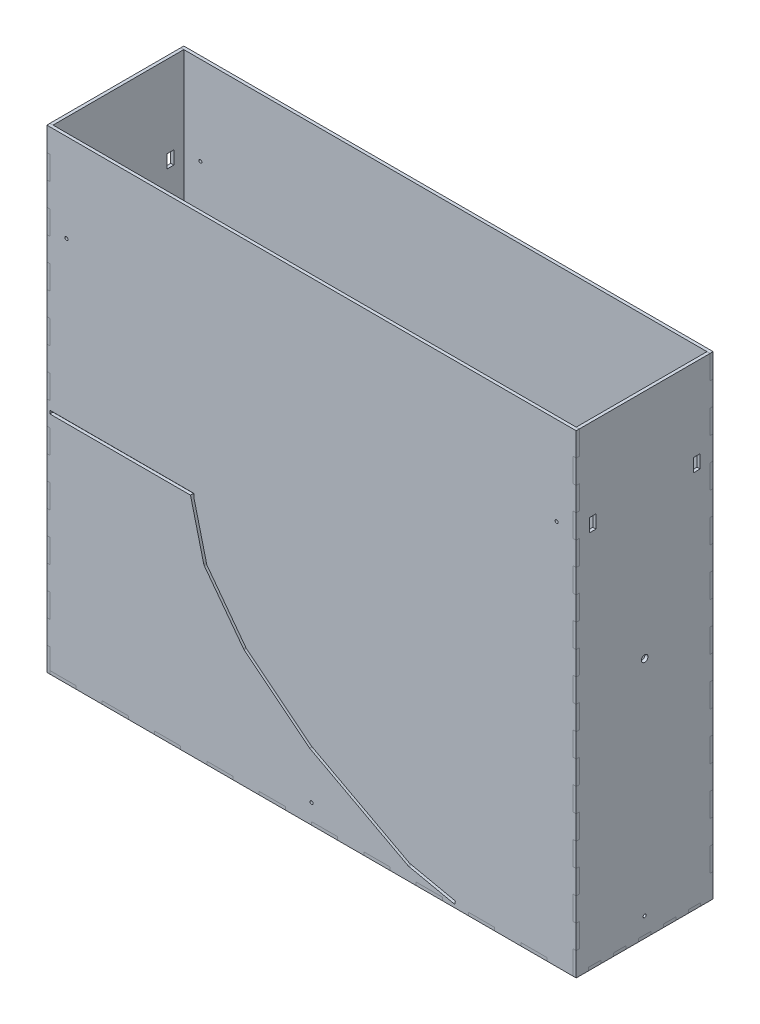
from build123d import *

# Parameters (mm, degrees)
SKETCH1_W                     = 513.9944
SKETCH1_H                     = 132.9944
SKETCH1_W_2                   = 508
SKETCH1_H_2                   = 127
BASE_EXTRUDE_DEPTH            = 2.9972
SKETCH1_3_W                   = 513.9944
SKETCH1_3_H                   = 132.9944
SKETCH1_3_W_2                 = 508
SKETCH1_3_H_2                 = 127
WALL_EXTRUDE_DEPTH            = 460.1972
SKETCH2_W                     = 139.7
SKETCH2_H                     = 3.1242
CUT_EXTRUDE2_DEPTH            = 544.614324799
SPLIT3_DEPTH                  = 2.9972
SPLIT3_2_DEPTH                = 2.9972
SPLIT2_START                  = -63.5
SPLIT2_OUTLINE_W              = 2.9972
SPLIT2_OUTLINE_H              = 457.2
SPLIT2_DEPTH                  = 127
SPLIT2_START_2                = -66.4972
SPLIT2_2_OUTLINE_W            = 2.9972
SPLIT2_2_OUTLINE_H            = 23.00986
SPLIT2_2_OUTLINE_H_2          = 20.01266
SPLIT2_2_DEPTH                = 132.9944
SPLIT2_3_OUTLINE_W            = 2.9972
SPLIT2_3_OUTLINE_H            = 2.9972
SPLIT2_3_DEPTH                = 12.0904
SPLIT2_START_3                = -42.3164
SPLIT2_4_OUTLINE_W            = 2.9972
SPLIT2_4_OUTLINE_H            = 2.9972
SPLIT2_4_DEPTH                = 12.0904
SPLIT2_START_4                = -18.1356
SPLIT2_5_OUTLINE_W            = 2.9972
SPLIT2_5_OUTLINE_H            = 2.9972
SPLIT2_5_DEPTH                = 12.0904
SPLIT2_START_5                = 6.0452
SPLIT2_6_OUTLINE_W            = 2.9972
SPLIT2_6_OUTLINE_H            = 2.9972
SPLIT2_6_DEPTH                = 12.0904
SPLIT2_START_6                = 30.226
SPLIT2_7_OUTLINE_W            = 2.9972
SPLIT2_7_OUTLINE_H            = 2.9972
SPLIT2_7_DEPTH                = 12.0904
SPLIT2_START_7                = 54.4068
SPLIT2_8_OUTLINE_W            = 2.9972
SPLIT2_8_OUTLINE_H            = 2.9972
SPLIT2_8_DEPTH                = 12.0904
SPLIT2_9_OUTLINE_W            = 2.9972
SPLIT2_9_OUTLINE_H            = 127
SPLIT2_9_DEPTH                = 460.1972
SPLIT2_10_OUTLINE_W           = 2.9972
SPLIT2_10_OUTLINE_H           = 2.9972
SPLIT2_10_DEPTH               = 23.00986
SPLIT2_START_8                = 46.01972
SPLIT2_11_OUTLINE_W           = 2.9972
SPLIT2_11_OUTLINE_H           = 2.9972
SPLIT2_11_DEPTH               = 23.00986
SPLIT2_START_9                = 92.03944
SPLIT2_12_OUTLINE_W           = 2.9972
SPLIT2_12_OUTLINE_H           = 2.9972
SPLIT2_12_DEPTH               = 23.00986
SPLIT2_START_10               = 138.05916
SPLIT2_13_OUTLINE_W           = 2.9972
SPLIT2_13_OUTLINE_H           = 2.9972
SPLIT2_13_DEPTH               = 23.00986
SPLIT2_START_11               = 184.07888
SPLIT2_14_OUTLINE_W           = 2.9972
SPLIT2_14_OUTLINE_H           = 2.9972
SPLIT2_14_DEPTH               = 23.00986
SPLIT2_START_12               = 230.0986
SPLIT2_15_OUTLINE_W           = 2.9972
SPLIT2_15_OUTLINE_H           = 2.9972
SPLIT2_15_DEPTH               = 23.00986
SPLIT2_START_13               = 276.11832
SPLIT2_16_OUTLINE_W           = 2.9972
SPLIT2_16_OUTLINE_H           = 2.9972
SPLIT2_16_DEPTH               = 23.00986
SPLIT2_START_14               = 322.13804
SPLIT2_17_OUTLINE_W           = 2.9972
SPLIT2_17_OUTLINE_H           = 2.9972
SPLIT2_17_DEPTH               = 23.00986
SPLIT2_START_15               = 368.15776
SPLIT2_18_OUTLINE_W           = 2.9972
SPLIT2_18_OUTLINE_H           = 2.9972
SPLIT2_18_DEPTH               = 23.00986
SPLIT2_START_16               = 414.17748
SPLIT2_19_OUTLINE_W           = 2.9972
SPLIT2_19_OUTLINE_H           = 2.9972
SPLIT2_19_DEPTH               = 23.00986
SPLIT4_DEPTH                  = 460.1972
SPLIT4_2_OUTLINE_W            = 2.9972
SPLIT4_2_OUTLINE_H            = 2.9972
SPLIT4_2_DEPTH                = 23.00986
SPLIT4_START                  = 46.01972
SPLIT4_3_OUTLINE_W            = 2.9972
SPLIT4_3_OUTLINE_H            = 2.9972
SPLIT4_3_DEPTH                = 23.00986
SPLIT4_START_2                = 92.03944
SPLIT4_4_OUTLINE_W            = 2.9972
SPLIT4_4_OUTLINE_H            = 2.9972
SPLIT4_4_DEPTH                = 23.00986
SPLIT4_START_3                = 138.05916
SPLIT4_5_OUTLINE_W            = 2.9972
SPLIT4_5_OUTLINE_H            = 2.9972
SPLIT4_5_DEPTH                = 23.00986
SPLIT4_START_4                = 184.07888
SPLIT4_6_OUTLINE_W            = 2.9972
SPLIT4_6_OUTLINE_H            = 2.9972
SPLIT4_6_DEPTH                = 23.00986
SPLIT4_START_5                = 230.0986
SPLIT4_7_OUTLINE_W            = 2.9972
SPLIT4_7_OUTLINE_H            = 2.9972
SPLIT4_7_DEPTH                = 23.00986
SPLIT4_START_6                = 276.11832
SPLIT4_8_OUTLINE_W            = 2.9972
SPLIT4_8_OUTLINE_H            = 2.9972
SPLIT4_8_DEPTH                = 23.00986
SPLIT4_START_7                = 322.13804
SPLIT4_9_OUTLINE_W            = 2.9972
SPLIT4_9_OUTLINE_H            = 2.9972
SPLIT4_9_DEPTH                = 23.00986
SPLIT4_START_8                = 368.15776
SPLIT4_10_OUTLINE_W           = 2.9972
SPLIT4_10_OUTLINE_H           = 2.9972
SPLIT4_10_DEPTH               = 23.00986
SPLIT4_START_9                = 414.17748
SPLIT4_11_OUTLINE_W           = 2.9972
SPLIT4_11_OUTLINE_H           = 2.9972
SPLIT4_11_DEPTH               = 23.00986
SPLIT4_START_10               = -66.4972
SPLIT4_12_DEPTH               = 2.9972
SPLIT4_START_11               = 2.9972
SPLIT4_13_OUTLINE_W           = 2.9972
SPLIT4_13_OUTLINE_H           = 127
SPLIT4_13_DEPTH               = 457.2
SPLIT4_14_OUTLINE_W           = 2.9972
SPLIT4_14_OUTLINE_H           = 12.0904
SPLIT4_14_DEPTH               = 23.00986
SPLIT4_15_OUTLINE_W           = 2.9972
SPLIT4_15_OUTLINE_H           = 2.9972
SPLIT4_15_DEPTH               = 23.00986
SPLIT4_16_OUTLINE_W           = 2.9972
SPLIT4_16_OUTLINE_H           = 2.9972
SPLIT4_16_DEPTH               = 23.00986
SPLIT4_17_OUTLINE_W           = 2.9972
SPLIT4_17_OUTLINE_H           = 2.9972
SPLIT4_17_DEPTH               = 23.00986
SPLIT4_18_OUTLINE_W           = 2.9972
SPLIT4_18_OUTLINE_H           = 2.9972
SPLIT4_18_DEPTH               = 23.00986
SPLIT4_19_OUTLINE_W           = 2.9972
SPLIT4_19_OUTLINE_H           = 2.9972
SPLIT4_19_DEPTH               = 23.00986
SPLIT4_20_OUTLINE_W           = 2.9972
SPLIT4_20_OUTLINE_H           = 2.9972
SPLIT4_20_DEPTH               = 23.00986
SPLIT4_21_OUTLINE_W           = 2.9972
SPLIT4_21_OUTLINE_H           = 2.9972
SPLIT4_21_DEPTH               = 23.00986
SPLIT4_22_OUTLINE_W           = 2.9972
SPLIT4_22_OUTLINE_H           = 2.9972
SPLIT4_22_DEPTH               = 23.00986
SPLIT4_23_OUTLINE_W           = 2.9972
SPLIT4_23_OUTLINE_H           = 2.9972
SPLIT4_23_DEPTH               = 23.00986
SKETCH14_R                    = 3.175
TETHER_HOLE_DEPTH             = 694.104309413
SKETCH16_W                    = 6.477
SKETCH16_H                    = 12.827
SKETCH16_W_2                  = 12.7
SKETCH16_H_2                  = 6.604
SKETCH16_W_3                  = 3.175
BOTTOM_SUPPORT_HOLES_DEPTH    = 532.272906615
SKETCH17_R                    = 1.5
FRONTBACK_SUPPORT_HOLES_DEPTH = 544.614324799
SKETCH18_R                    = 1.5
SKETCH18_W                    = 6.477
SKETCH18_H                    = 12.827
SIDE_SUPPORT_HOLES_DEPTH      = 694.104309413


# Read off the part's stored shape, not the designer's step: Split3, Split2, Split4
with BuildPart() as part:
    # Sketch1 → Base Extrude (new body)
    # profile 1 of 2: a face of its own
    with BuildSketch(Plane(origin=(0, 0, 0), x_dir=(1, 0, 0), z_dir=(0, 1, 0))):
        Rectangle(SKETCH1_W, SKETCH1_H)
        Rectangle(SKETCH1_W_2, SKETCH1_H_2, mode=Mode.SUBTRACT)
    # profile 2 of 2: a face of its own
    with BuildSketch(Plane(origin=(0, 0, 0), x_dir=(1, 0, 0), z_dir=(0, 1, 0))):
        Rectangle(SKETCH1_W_2, SKETCH1_H_2)
    extrude(amount=BASE_EXTRUDE_DEPTH)

    # Sketch1<3> → Wall Extrude (add)
    with BuildSketch(Plane(origin=(0, 0, 0), x_dir=(1, 0, 0), z_dir=(0, 1, 0))):
        Rectangle(SKETCH1_3_W, SKETCH1_3_H)
        Rectangle(SKETCH1_3_W_2, SKETCH1_3_H_2, mode=Mode.SUBTRACT)
    extrude(amount=WALL_EXTRUDE_DEPTH)

    # Sketch2 → Cut-Extrude2 (cut, through all)
    with BuildSketch(Plane.XY.offset(66.4972)):
        with Locations((-184.15, 220.339150302)):
            Rectangle(SKETCH2_W, SKETCH2_H)
        Polygon((-117.330919199, 218.019320502), (-104.630919199, 167.219320502), (-101.6, 167.977050302), (-114.3, 218.777050302), align=None)
        Polygon((-104.09936, 166.102530302), (-65.99936, 115.302530302), (-63.5, 117.177050302), (-101.6, 167.977050302), align=None)
        Polygon((-104.09936, 166.102530302), (-104.630919199, 167.219320502), (-101.6, 167.977050302), align=None)
        Polygon((-65.451672268, 114.737459968), (-1.951672268, 63.937459968), (0, 66.377050302), (-63.5, 117.177050302), align=None)
        Polygon((-65.451672268, 114.737459968), (-65.99936, 115.302530302), (-63.5, 117.177050302), align=None)
        Polygon((-1.470211765, 63.620403243), (93.779788235, 12.820403243), (95.25, 15.577050302), (0, 66.377050302), align=None)
        Polygon((-1.470211765, 63.620403243), (-1.951672268, 63.937459968), (0, 66.377050302), align=None)
        Polygon((139.7, 6.052050302), (139.045389221, 2.9972), (94.595389221, 12.5222), (95.25, 15.577050302), align=None)
        Polygon((94.595389221, 12.5222), (93.779788235, 12.820403243), (95.25, 15.577050302), align=None)
        Polygon((-117.330919199, 218.019320502), (-114.3, 218.777050302), (-117.520351649, 218.777050302), align=None)
    extrude(amount=-CUT_EXTRUDE2_DEPTH, mode=Mode.SUBTRACT)

    # Split3 2 outline → Split3 2 (cut)
    with BuildSketch(Plane(origin=(0, 0, 0), x_dir=(1, 0, 0), z_dir=(0, 1, 0))):
        Polygon((-256.9972, 54.4068), (-256.9972, 42.3164), (-254, 42.3164), (-254, 30.226), (-256.9972, 30.226), (-256.9972, 18.1356), (-254, 18.1356), (-254, 6.0452), (-256.9972, 6.0452), (-256.9972, -6.0452), (-254, -6.0452), (-254, -18.1356), (-256.9972, -18.1356), (-256.9972, -30.226), (-254, -30.226), (-254, -42.3164), (-256.9972, -42.3164), (-256.9972, -54.4068), (-254, -54.4068), (-254, -66.4972), (-228.6, -66.4972), (-228.6, -63.5), (-203.2, -63.5), (-203.2, -66.4972), (-177.8, -66.4972), (-177.8, -63.5), (-152.4, -63.5), (-152.4, -66.4972), (-127, -66.4972), (-127, -63.5), (-101.6, -63.5), (-101.6, -66.4972), (-76.2, -66.4972), (-76.2, -63.5), (-50.8, -63.5), (-50.8, -66.4972), (-25.4, -66.4972), (-25.4, -63.5), (0, -63.5), (0, -66.4972), (25.4, -66.4972), (25.4, -63.5), (50.8, -63.5), (50.8, -66.4972), (76.2, -66.4972), (76.2, -63.5), (101.6, -63.5), (101.6, -66.4972), (127, -66.4972), (127, -63.5), (152.4, -63.5), (152.4, -66.4972), (177.8, -66.4972), (177.8, -63.5), (203.2, -63.5), (203.2, -66.4972), (228.6, -66.4972), (228.6, -63.5), (254, -63.5), (254, -54.4068), (256.9972, -54.4068), (256.9972, -42.3164), (254, -42.3164), (254, -30.226), (256.9972, -30.226), (256.9972, -18.1356), (254, -18.1356), (254, -6.0452), (256.9972, -6.0452), (256.9972, 6.0452), (254, 6.0452), (254, 18.1356), (256.9972, 18.1356), (256.9972, 30.226), (254, 30.226), (254, 42.3164), (256.9972, 42.3164), (256.9972, 54.4068), (254, 54.4068), (254, 63.5), (228.6, 63.5), (228.6, 66.4972), (203.2, 66.4972), (203.2, 63.5), (177.8, 63.5), (177.8, 66.4972), (152.4, 66.4972), (152.4, 63.5), (127, 63.5), (127, 66.4972), (101.6, 66.4972), (101.6, 63.5), (76.2, 63.5), (76.2, 66.4972), (50.8, 66.4972), (50.8, 63.5), (25.4, 63.5), (25.4, 66.4972), (0, 66.4972), (0, 63.5), (-25.4, 63.5), (-25.4, 66.4972), (-50.8, 66.4972), (-50.8, 63.5), (-76.2, 63.5), (-76.2, 66.4972), (-101.6, 66.4972), (-101.6, 63.5), (-127, 63.5), (-127, 66.4972), (-152.4, 66.4972), (-152.4, 63.5), (-177.8, 63.5), (-177.8, 66.4972), (-203.2, 66.4972), (-203.2, 63.5), (-228.6, 63.5), (-228.6, 66.4972), (-254, 66.4972), (-254, 54.4068), align=None)
    extrude(amount=SPLIT3_2_DEPTH, mode=Mode.SUBTRACT)

    # Split2 9 outline → Split2 9 (cut)
    with BuildSketch(Plane(origin=(0, 0, 0), x_dir=(1, 0, 0), z_dir=(0, 1, 0))):
        with Locations((-255.4986, 0)):
            Rectangle(SPLIT2_9_OUTLINE_W, SPLIT2_9_OUTLINE_H)
    extrude(amount=SPLIT2_9_DEPTH, mode=Mode.SUBTRACT)

    # Split2 10 outline → Split2 10 (cut)
    with BuildSketch(Plane(origin=(0, 0, 0), x_dir=(1, 0, 0), z_dir=(0, 1, 0))):
        with Locations((-255.4986, -64.9986)):
            Rectangle(SPLIT2_10_OUTLINE_W, SPLIT2_10_OUTLINE_H)
        with Locations((-255.4986, 64.9986)):
            Rectangle(SPLIT2_10_OUTLINE_W, SPLIT2_10_OUTLINE_H)
    extrude(amount=SPLIT2_10_DEPTH, mode=Mode.SUBTRACT)

    # Split2 11 outline → Split2 11 (cut)
    with BuildSketch(Plane(origin=(0, 0, 0), x_dir=(1, 0, 0), z_dir=(0, 1, 0)).offset(SPLIT2_START_8)):
        with Locations((-255.4986, -64.9986)):
            Rectangle(SPLIT2_11_OUTLINE_W, SPLIT2_11_OUTLINE_H)
        with Locations((-255.4986, 64.9986)):
            Rectangle(SPLIT2_11_OUTLINE_W, SPLIT2_11_OUTLINE_H)
    extrude(amount=SPLIT2_11_DEPTH, mode=Mode.SUBTRACT)

    # Split2 12 outline → Split2 12 (cut)
    with BuildSketch(Plane(origin=(0, 0, 0), x_dir=(1, 0, 0), z_dir=(0, 1, 0)).offset(SPLIT2_START_9)):
        with Locations((-255.4986, -64.9986)):
            Rectangle(SPLIT2_12_OUTLINE_W, SPLIT2_12_OUTLINE_H)
        with Locations((-255.4986, 64.9986)):
            Rectangle(SPLIT2_12_OUTLINE_W, SPLIT2_12_OUTLINE_H)
    extrude(amount=SPLIT2_12_DEPTH, mode=Mode.SUBTRACT)

    # Split2 13 outline → Split2 13 (cut)
    with BuildSketch(Plane(origin=(0, 0, 0), x_dir=(1, 0, 0), z_dir=(0, 1, 0)).offset(SPLIT2_START_10)):
        with Locations((-255.4986, -64.9986)):
            Rectangle(SPLIT2_13_OUTLINE_W, SPLIT2_13_OUTLINE_H)
        with Locations((-255.4986, 64.9986)):
            Rectangle(SPLIT2_13_OUTLINE_W, SPLIT2_13_OUTLINE_H)
    extrude(amount=SPLIT2_13_DEPTH, mode=Mode.SUBTRACT)

    # Split2 14 outline → Split2 14 (cut)
    with BuildSketch(Plane(origin=(0, 0, 0), x_dir=(1, 0, 0), z_dir=(0, 1, 0)).offset(SPLIT2_START_11)):
        with Locations((-255.4986, -64.9986)):
            Rectangle(SPLIT2_14_OUTLINE_W, SPLIT2_14_OUTLINE_H)
        with Locations((-255.4986, 64.9986)):
            Rectangle(SPLIT2_14_OUTLINE_W, SPLIT2_14_OUTLINE_H)
    extrude(amount=SPLIT2_14_DEPTH, mode=Mode.SUBTRACT)

    # Split2 15 outline → Split2 15 (cut)
    with BuildSketch(Plane(origin=(0, 0, 0), x_dir=(1, 0, 0), z_dir=(0, 1, 0)).offset(SPLIT2_START_12)):
        with Locations((-255.4986, -64.9986)):
            Rectangle(SPLIT2_15_OUTLINE_W, SPLIT2_15_OUTLINE_H)
        with Locations((-255.4986, 64.9986)):
            Rectangle(SPLIT2_15_OUTLINE_W, SPLIT2_15_OUTLINE_H)
    extrude(amount=SPLIT2_15_DEPTH, mode=Mode.SUBTRACT)

    # Split2 16 outline → Split2 16 (cut)
    with BuildSketch(Plane(origin=(0, 0, 0), x_dir=(1, 0, 0), z_dir=(0, 1, 0)).offset(SPLIT2_START_13)):
        with Locations((-255.4986, -64.9986)):
            Rectangle(SPLIT2_16_OUTLINE_W, SPLIT2_16_OUTLINE_H)
        with Locations((-255.4986, 64.9986)):
            Rectangle(SPLIT2_16_OUTLINE_W, SPLIT2_16_OUTLINE_H)
    extrude(amount=SPLIT2_16_DEPTH, mode=Mode.SUBTRACT)

    # Split2 17 outline → Split2 17 (cut)
    with BuildSketch(Plane(origin=(0, 0, 0), x_dir=(1, 0, 0), z_dir=(0, 1, 0)).offset(SPLIT2_START_14)):
        with Locations((-255.4986, -64.9986)):
            Rectangle(SPLIT2_17_OUTLINE_W, SPLIT2_17_OUTLINE_H)
        with Locations((-255.4986, 64.9986)):
            Rectangle(SPLIT2_17_OUTLINE_W, SPLIT2_17_OUTLINE_H)
    extrude(amount=SPLIT2_17_DEPTH, mode=Mode.SUBTRACT)

    # Split2 18 outline → Split2 18 (cut)
    with BuildSketch(Plane(origin=(0, 0, 0), x_dir=(1, 0, 0), z_dir=(0, 1, 0)).offset(SPLIT2_START_15)):
        with Locations((-255.4986, -64.9986)):
            Rectangle(SPLIT2_18_OUTLINE_W, SPLIT2_18_OUTLINE_H)
        with Locations((-255.4986, 64.9986)):
            Rectangle(SPLIT2_18_OUTLINE_W, SPLIT2_18_OUTLINE_H)
    extrude(amount=SPLIT2_18_DEPTH, mode=Mode.SUBTRACT)

    # Split2 19 outline → Split2 19 (cut)
    with BuildSketch(Plane(origin=(0, 0, 0), x_dir=(1, 0, 0), z_dir=(0, 1, 0)).offset(SPLIT2_START_16)):
        with Locations((-255.4986, -64.9986)):
            Rectangle(SPLIT2_19_OUTLINE_W, SPLIT2_19_OUTLINE_H)
        with Locations((-255.4986, 64.9986)):
            Rectangle(SPLIT2_19_OUTLINE_W, SPLIT2_19_OUTLINE_H)
    extrude(amount=SPLIT2_19_DEPTH, mode=Mode.SUBTRACT)

    # Split4 outline → Split4 (cut)
    with BuildSketch(Plane(origin=(0, 0, 0), x_dir=(1, 0, 0), z_dir=(0, 1, 0))):
        Polygon((254, -63.5), (256.9972, -63.5), (256.9972, 66.4972), (-256.9972, 66.4972), (-256.9972, 63.5), (254, 63.5), align=None)
    extrude(amount=SPLIT4_DEPTH, mode=Mode.SUBTRACT)

    # Split4 2 outline → Split4 2 (cut)
    with BuildSketch(Plane(origin=(0, 0, 0), x_dir=(1, 0, 0), z_dir=(0, 1, 0))):
        with Locations((255.4986, -64.9986)):
            Rectangle(SPLIT4_2_OUTLINE_W, SPLIT4_2_OUTLINE_H)
    extrude(amount=SPLIT4_2_DEPTH, mode=Mode.SUBTRACT)

    # Split4 3 outline → Split4 3 (cut)
    with BuildSketch(Plane(origin=(0, 0, 0), x_dir=(1, 0, 0), z_dir=(0, 1, 0)).offset(SPLIT4_START)):
        with Locations((255.4986, -64.9986)):
            Rectangle(SPLIT4_3_OUTLINE_W, SPLIT4_3_OUTLINE_H)
    extrude(amount=SPLIT4_3_DEPTH, mode=Mode.SUBTRACT)

    # Split4 4 outline → Split4 4 (cut)
    with BuildSketch(Plane(origin=(0, 0, 0), x_dir=(1, 0, 0), z_dir=(0, 1, 0)).offset(SPLIT4_START_2)):
        with Locations((255.4986, -64.9986)):
            Rectangle(SPLIT4_4_OUTLINE_W, SPLIT4_4_OUTLINE_H)
    extrude(amount=SPLIT4_4_DEPTH, mode=Mode.SUBTRACT)

    # Split4 5 outline → Split4 5 (cut)
    with BuildSketch(Plane(origin=(0, 0, 0), x_dir=(1, 0, 0), z_dir=(0, 1, 0)).offset(SPLIT4_START_3)):
        with Locations((255.4986, -64.9986)):
            Rectangle(SPLIT4_5_OUTLINE_W, SPLIT4_5_OUTLINE_H)
    extrude(amount=SPLIT4_5_DEPTH, mode=Mode.SUBTRACT)

    # Split4 6 outline → Split4 6 (cut)
    with BuildSketch(Plane(origin=(0, 0, 0), x_dir=(1, 0, 0), z_dir=(0, 1, 0)).offset(SPLIT4_START_4)):
        with Locations((255.4986, -64.9986)):
            Rectangle(SPLIT4_6_OUTLINE_W, SPLIT4_6_OUTLINE_H)
    extrude(amount=SPLIT4_6_DEPTH, mode=Mode.SUBTRACT)

    # Split4 7 outline → Split4 7 (cut)
    with BuildSketch(Plane(origin=(0, 0, 0), x_dir=(1, 0, 0), z_dir=(0, 1, 0)).offset(SPLIT4_START_5)):
        with Locations((255.4986, -64.9986)):
            Rectangle(SPLIT4_7_OUTLINE_W, SPLIT4_7_OUTLINE_H)
    extrude(amount=SPLIT4_7_DEPTH, mode=Mode.SUBTRACT)

    # Split4 8 outline → Split4 8 (cut)
    with BuildSketch(Plane(origin=(0, 0, 0), x_dir=(1, 0, 0), z_dir=(0, 1, 0)).offset(SPLIT4_START_6)):
        with Locations((255.4986, -64.9986)):
            Rectangle(SPLIT4_8_OUTLINE_W, SPLIT4_8_OUTLINE_H)
    extrude(amount=SPLIT4_8_DEPTH, mode=Mode.SUBTRACT)

    # Split4 9 outline → Split4 9 (cut)
    with BuildSketch(Plane(origin=(0, 0, 0), x_dir=(1, 0, 0), z_dir=(0, 1, 0)).offset(SPLIT4_START_7)):
        with Locations((255.4986, -64.9986)):
            Rectangle(SPLIT4_9_OUTLINE_W, SPLIT4_9_OUTLINE_H)
    extrude(amount=SPLIT4_9_DEPTH, mode=Mode.SUBTRACT)

    # Split4 10 outline → Split4 10 (cut)
    with BuildSketch(Plane(origin=(0, 0, 0), x_dir=(1, 0, 0), z_dir=(0, 1, 0)).offset(SPLIT4_START_8)):
        with Locations((255.4986, -64.9986)):
            Rectangle(SPLIT4_10_OUTLINE_W, SPLIT4_10_OUTLINE_H)
    extrude(amount=SPLIT4_10_DEPTH, mode=Mode.SUBTRACT)

    # Split4 11 outline → Split4 11 (cut)
    with BuildSketch(Plane(origin=(0, 0, 0), x_dir=(1, 0, 0), z_dir=(0, 1, 0)).offset(SPLIT4_START_9)):
        with Locations((255.4986, -64.9986)):
            Rectangle(SPLIT4_11_OUTLINE_W, SPLIT4_11_OUTLINE_H)
    extrude(amount=SPLIT4_11_DEPTH, mode=Mode.SUBTRACT)


with BuildPart() as body_2:
    # Split3 outline → Split3 (new body)
    with BuildSketch(Plane(origin=(0, 0, 0), x_dir=(1, 0, 0), z_dir=(0, 1, 0))):
        Polygon((203.2, 66.4972), (203.2, 63.5), (177.8, 63.5), (177.8, 66.4972), (152.4, 66.4972), (152.4, 63.5), (127, 63.5), (127, 66.4972), (101.6, 66.4972), (101.6, 63.5), (76.2, 63.5), (76.2, 66.4972), (50.8, 66.4972), (50.8, 63.5), (25.4, 63.5), (25.4, 66.4972), (0, 66.4972), (0, 63.5), (-25.4, 63.5), (-25.4, 66.4972), (-50.8, 66.4972), (-50.8, 63.5), (-76.2, 63.5), (-76.2, 66.4972), (-101.6, 66.4972), (-101.6, 63.5), (-127, 63.5), (-127, 66.4972), (-152.4, 66.4972), (-152.4, 63.5), (-177.8, 63.5), (-177.8, 66.4972), (-203.2, 66.4972), (-203.2, 63.5), (-228.6, 63.5), (-228.6, 66.4972), (-254, 66.4972), (-254, 54.4068), (-256.9972, 54.4068), (-256.9972, 42.3164), (-254, 42.3164), (-254, 30.226), (-256.9972, 30.226), (-256.9972, 18.1356), (-254, 18.1356), (-254, 6.0452), (-256.9972, 6.0452), (-256.9972, -6.0452), (-254, -6.0452), (-254, -18.1356), (-256.9972, -18.1356), (-256.9972, -30.226), (-254, -30.226), (-254, -42.3164), (-256.9972, -42.3164), (-256.9972, -54.4068), (-254, -54.4068), (-254, -66.4972), (-228.6, -66.4972), (-228.6, -63.5), (-203.2, -63.5), (-203.2, -66.4972), (-177.8, -66.4972), (-177.8, -63.5), (-152.4, -63.5), (-152.4, -66.4972), (-127, -66.4972), (-127, -63.5), (-101.6, -63.5), (-101.6, -66.4972), (-76.2, -66.4972), (-76.2, -63.5), (-50.8, -63.5), (-50.8, -66.4972), (-25.4, -66.4972), (-25.4, -63.5), (0, -63.5), (0, -66.4972), (25.4, -66.4972), (25.4, -63.5), (50.8, -63.5), (50.8, -66.4972), (76.2, -66.4972), (76.2, -63.5), (101.6, -63.5), (101.6, -66.4972), (127, -66.4972), (127, -63.5), (152.4, -63.5), (152.4, -66.4972), (177.8, -66.4972), (177.8, -63.5), (203.2, -63.5), (203.2, -66.4972), (228.6, -66.4972), (228.6, -63.5), (254, -63.5), (254, -54.4068), (256.9972, -54.4068), (256.9972, -42.3164), (254, -42.3164), (254, -30.226), (256.9972, -30.226), (256.9972, -18.1356), (254, -18.1356), (254, -6.0452), (256.9972, -6.0452), (256.9972, 6.0452), (254, 6.0452), (254, 18.1356), (256.9972, 18.1356), (256.9972, 30.226), (254, 30.226), (254, 42.3164), (256.9972, 42.3164), (256.9972, 54.4068), (254, 54.4068), (254, 63.5), (228.6, 63.5), (228.6, 66.4972), align=None)
    extrude(amount=SPLIT3_DEPTH)

    # Sketch16 → Bottom Support Holes (cut, through all)
    with BuildSketch(Plane.XZ):
        with Locations((-241.0587, 0)):
            Rectangle(SKETCH16_W, SKETCH16_H)
        with Locations((0, 50.4952)):
            Rectangle(SKETCH16_W_2, SKETCH16_H_2)
        with Locations((0, -50.4952)):
            Rectangle(SKETCH16_W_2, SKETCH16_H_2)
        with Locations((242.7097, 0)):
            Rectangle(SKETCH16_W_3, SKETCH16_H)
    extrude(amount=-BOTTOM_SUPPORT_HOLES_DEPTH, mode=Mode.SUBTRACT)


with BuildPart() as body_3:
    # Split2 outline → Split2 (new body)
    with BuildSketch(Plane.XY.offset(SPLIT2_START)):
        with Locations((-255.4986, 231.5972)):
            Rectangle(SPLIT2_OUTLINE_W, SPLIT2_OUTLINE_H)
    extrude(amount=SPLIT2_DEPTH)

    # Split2 2 outline → Split2 2 (add)
    with BuildSketch(Plane.XY.offset(SPLIT2_START_2)):
        with Locations((-255.4986, 57.52465)):
            Rectangle(SPLIT2_2_OUTLINE_W, SPLIT2_2_OUTLINE_H)
        with Locations((-255.4986, 13.00353)):
            Rectangle(SPLIT2_2_OUTLINE_W, SPLIT2_2_OUTLINE_H_2)
        with Locations((-255.4986, 103.54437)):
            Rectangle(SPLIT2_2_OUTLINE_W, SPLIT2_2_OUTLINE_H)
        with Locations((-255.4986, 149.56409)):
            Rectangle(SPLIT2_2_OUTLINE_W, SPLIT2_2_OUTLINE_H)
        with Locations((-255.4986, 195.58381)):
            Rectangle(SPLIT2_2_OUTLINE_W, SPLIT2_2_OUTLINE_H)
        with Locations((-255.4986, 241.60353)):
            Rectangle(SPLIT2_2_OUTLINE_W, SPLIT2_2_OUTLINE_H)
        with Locations((-255.4986, 287.62325)):
            Rectangle(SPLIT2_2_OUTLINE_W, SPLIT2_2_OUTLINE_H)
        with Locations((-255.4986, 333.64297)):
            Rectangle(SPLIT2_2_OUTLINE_W, SPLIT2_2_OUTLINE_H)
        with Locations((-255.4986, 379.66269)):
            Rectangle(SPLIT2_2_OUTLINE_W, SPLIT2_2_OUTLINE_H)
        with Locations((-255.4986, 425.68241)):
            Rectangle(SPLIT2_2_OUTLINE_W, SPLIT2_2_OUTLINE_H)
    extrude(amount=SPLIT2_2_DEPTH)

    # Split2 3 outline → Split2 3 (add)
    with BuildSketch(Plane.XY.offset(SPLIT2_START_2)):
        with Locations((-255.4986, 1.4986)):
            Rectangle(SPLIT2_3_OUTLINE_W, SPLIT2_3_OUTLINE_H)
    extrude(amount=SPLIT2_3_DEPTH)

    # Split2 4 outline → Split2 4 (add)
    with BuildSketch(Plane.XY.offset(SPLIT2_START_3)):
        with Locations((-255.4986, 1.4986)):
            Rectangle(SPLIT2_4_OUTLINE_W, SPLIT2_4_OUTLINE_H)
    extrude(amount=SPLIT2_4_DEPTH)

    # Split2 5 outline → Split2 5 (add)
    with BuildSketch(Plane.XY.offset(SPLIT2_START_4)):
        with Locations((-255.4986, 1.4986)):
            Rectangle(SPLIT2_5_OUTLINE_W, SPLIT2_5_OUTLINE_H)
    extrude(amount=SPLIT2_5_DEPTH)

    # Split2 6 outline → Split2 6 (add)
    with BuildSketch(Plane.XY.offset(SPLIT2_START_5)):
        with Locations((-255.4986, 1.4986)):
            Rectangle(SPLIT2_6_OUTLINE_W, SPLIT2_6_OUTLINE_H)
    extrude(amount=SPLIT2_6_DEPTH)

    # Split2 7 outline → Split2 7 (add)
    with BuildSketch(Plane.XY.offset(SPLIT2_START_6)):
        with Locations((-255.4986, 1.4986)):
            Rectangle(SPLIT2_7_OUTLINE_W, SPLIT2_7_OUTLINE_H)
    extrude(amount=SPLIT2_7_DEPTH)

    # Split2 8 outline → Split2 8 (add)
    with BuildSketch(Plane.XY.offset(SPLIT2_START_7)):
        with Locations((-255.4986, 1.4986)):
            Rectangle(SPLIT2_8_OUTLINE_W, SPLIT2_8_OUTLINE_H)
    extrude(amount=SPLIT2_8_DEPTH)


with BuildPart() as body_4:
    # Split4 12 outline → Split4 12 (new body)
    with BuildSketch(Plane.XY.offset(SPLIT4_START_10)):
        Polygon((254, 46.01972), (254, 69.02958), (256.9972, 69.02958), (256.9972, 92.03944), (254, 92.03944), (254, 115.0493), (256.9972, 115.0493), (256.9972, 138.05916), (254, 138.05916), (254, 161.06902), (256.9972, 161.06902), (256.9972, 184.07888), (254, 184.07888), (254, 207.08874), (256.9972, 207.08874), (256.9972, 230.0986), (254, 230.0986), (254, 253.10846), (256.9972, 253.10846), (256.9972, 276.11832), (254, 276.11832), (254, 299.12818), (256.9972, 299.12818), (256.9972, 322.13804), (254, 322.13804), (254, 345.1479), (256.9972, 345.1479), (256.9972, 368.15776), (254, 368.15776), (254, 391.16762), (256.9972, 391.16762), (256.9972, 414.17748), (254, 414.17748), (254, 437.18734), (256.9972, 437.18734), (256.9972, 460.1972), (-256.9972, 460.1972), (-256.9972, 437.18734), (-254, 437.18734), (-254, 414.17748), (-256.9972, 414.17748), (-256.9972, 391.16762), (-254, 391.16762), (-254, 368.15776), (-256.9972, 368.15776), (-256.9972, 345.1479), (-254, 345.1479), (-254, 322.13804), (-256.9972, 322.13804), (-256.9972, 299.12818), (-254, 299.12818), (-254, 276.11832), (-256.9972, 276.11832), (-256.9972, 253.10846), (-254, 253.10846), (-254, 230.0986), (-256.9972, 230.0986), (-256.9972, 207.08874), (-254, 207.08874), (-254, 184.07888), (-256.9972, 184.07888), (-256.9972, 161.06902), (-254, 161.06902), (-254, 138.05916), (-256.9972, 138.05916), (-256.9972, 115.0493), (-254, 115.0493), (-254, 92.03944), (-256.9972, 92.03944), (-256.9972, 69.02958), (-254, 69.02958), (-254, 46.01972), (-256.9972, 46.01972), (-256.9972, 23.00986), (-254, 23.00986), (-254, 2.9972), (-228.6, 2.9972), (-228.6, 0), (-203.2, 0), (-203.2, 2.9972), (-177.8, 2.9972), (-177.8, 0), (-152.4, 0), (-152.4, 2.9972), (-127, 2.9972), (-127, 0), (-101.6, 0), (-101.6, 2.9972), (-76.2, 2.9972), (-76.2, 0), (-50.8, 0), (-50.8, 2.9972), (-25.4, 2.9972), (-25.4, 0), (0, 0), (0, 2.9972), (25.4, 2.9972), (25.4, 0), (50.8, 0), (50.8, 2.9972), (76.2, 2.9972), (76.2, 0), (101.6, 0), (101.6, 2.9972), (127, 2.9972), (127, 0), (152.4, 0), (152.4, 2.9972), (177.8, 2.9972), (177.8, 0), (203.2, 0), (203.2, 2.9972), (228.6, 2.9972), (228.6, 0), (254, 0), (254, 23.00986), (256.9972, 23.00986), (256.9972, 46.01972), align=None)
        Polygon((-104.09936, 166.102530302), (-104.630919199, 167.219320502), (-117.520351649, 218.777050302), (-254, 218.777050302), (-254, 221.901250302), (-114.3, 221.901250302), (-114.3, 218.777050302), (-101.6, 167.977050302), (-63.5, 117.177050302), (0, 66.377050302), (95.25, 15.577050302), (139.7, 6.052050302), (139.045389221, 2.9972), (94.595389221, 12.5222), (93.779788235, 12.820403243), (-1.470211765, 63.620403243), (-1.951672268, 63.937459968), (-65.451672268, 114.737459968), (-65.99936, 115.302530302), align=None, mode=Mode.SUBTRACT)
    extrude(amount=SPLIT4_12_DEPTH)


with BuildPart() as body_5:
    # Split4 13 outline → Split4 13 (new body)
    with BuildSketch(Plane(origin=(0, 0, 0), x_dir=(1, 0, 0), z_dir=(0, 1, 0)).offset(SPLIT4_START_11)):
        with Locations((255.4986, 0)):
            Rectangle(SPLIT4_13_OUTLINE_W, SPLIT4_13_OUTLINE_H)
    extrude(amount=SPLIT4_13_DEPTH)

    # Split4 14 outline → Split4 14 (add)
    with BuildSketch(Plane(origin=(0, 0, 0), x_dir=(1, 0, 0), z_dir=(0, 1, 0))):
        with Locations((255.4986, 60.452)):
            Rectangle(SPLIT4_14_OUTLINE_W, SPLIT4_14_OUTLINE_H)
        with Locations((255.4986, 36.2712)):
            Rectangle(SPLIT4_14_OUTLINE_W, SPLIT4_14_OUTLINE_H)
        with Locations((255.4986, 12.0904)):
            Rectangle(SPLIT4_14_OUTLINE_W, SPLIT4_14_OUTLINE_H)
        with Locations((255.4986, -12.0904)):
            Rectangle(SPLIT4_14_OUTLINE_W, SPLIT4_14_OUTLINE_H)
        with Locations((255.4986, -36.2712)):
            Rectangle(SPLIT4_14_OUTLINE_W, SPLIT4_14_OUTLINE_H)
        with Locations((255.4986, -60.452)):
            Rectangle(SPLIT4_14_OUTLINE_W, SPLIT4_14_OUTLINE_H)
    extrude(amount=SPLIT4_14_DEPTH)

    # Split4 15 outline → Split4 15 (add)
    with BuildSketch(Plane(origin=(0, 0, 0), x_dir=(1, 0, 0), z_dir=(0, 1, 0)).offset(SPLIT4_START)):
        with Locations((255.4986, 64.9986)):
            Rectangle(SPLIT4_15_OUTLINE_W, SPLIT4_15_OUTLINE_H)
        with Locations((255.4986, -64.9986)):
            Rectangle(SPLIT4_15_OUTLINE_W, SPLIT4_15_OUTLINE_H)
    extrude(amount=SPLIT4_15_DEPTH)

    # Split4 16 outline → Split4 16 (add)
    with BuildSketch(Plane(origin=(0, 0, 0), x_dir=(1, 0, 0), z_dir=(0, 1, 0)).offset(SPLIT4_START_2)):
        with Locations((255.4986, 64.9986)):
            Rectangle(SPLIT4_16_OUTLINE_W, SPLIT4_16_OUTLINE_H)
        with Locations((255.4986, -64.9986)):
            Rectangle(SPLIT4_16_OUTLINE_W, SPLIT4_16_OUTLINE_H)
    extrude(amount=SPLIT4_16_DEPTH)

    # Split4 17 outline → Split4 17 (add)
    with BuildSketch(Plane(origin=(0, 0, 0), x_dir=(1, 0, 0), z_dir=(0, 1, 0)).offset(SPLIT4_START_3)):
        with Locations((255.4986, 64.9986)):
            Rectangle(SPLIT4_17_OUTLINE_W, SPLIT4_17_OUTLINE_H)
        with Locations((255.4986, -64.9986)):
            Rectangle(SPLIT4_17_OUTLINE_W, SPLIT4_17_OUTLINE_H)
    extrude(amount=SPLIT4_17_DEPTH)

    # Split4 18 outline → Split4 18 (add)
    with BuildSketch(Plane(origin=(0, 0, 0), x_dir=(1, 0, 0), z_dir=(0, 1, 0)).offset(SPLIT4_START_4)):
        with Locations((255.4986, 64.9986)):
            Rectangle(SPLIT4_18_OUTLINE_W, SPLIT4_18_OUTLINE_H)
        with Locations((255.4986, -64.9986)):
            Rectangle(SPLIT4_18_OUTLINE_W, SPLIT4_18_OUTLINE_H)
    extrude(amount=SPLIT4_18_DEPTH)

    # Split4 19 outline → Split4 19 (add)
    with BuildSketch(Plane(origin=(0, 0, 0), x_dir=(1, 0, 0), z_dir=(0, 1, 0)).offset(SPLIT4_START_5)):
        with Locations((255.4986, 64.9986)):
            Rectangle(SPLIT4_19_OUTLINE_W, SPLIT4_19_OUTLINE_H)
        with Locations((255.4986, -64.9986)):
            Rectangle(SPLIT4_19_OUTLINE_W, SPLIT4_19_OUTLINE_H)
    extrude(amount=SPLIT4_19_DEPTH)

    # Split4 20 outline → Split4 20 (add)
    with BuildSketch(Plane(origin=(0, 0, 0), x_dir=(1, 0, 0), z_dir=(0, 1, 0)).offset(SPLIT4_START_6)):
        with Locations((255.4986, 64.9986)):
            Rectangle(SPLIT4_20_OUTLINE_W, SPLIT4_20_OUTLINE_H)
        with Locations((255.4986, -64.9986)):
            Rectangle(SPLIT4_20_OUTLINE_W, SPLIT4_20_OUTLINE_H)
    extrude(amount=SPLIT4_20_DEPTH)

    # Split4 21 outline → Split4 21 (add)
    with BuildSketch(Plane(origin=(0, 0, 0), x_dir=(1, 0, 0), z_dir=(0, 1, 0)).offset(SPLIT4_START_7)):
        with Locations((255.4986, 64.9986)):
            Rectangle(SPLIT4_21_OUTLINE_W, SPLIT4_21_OUTLINE_H)
        with Locations((255.4986, -64.9986)):
            Rectangle(SPLIT4_21_OUTLINE_W, SPLIT4_21_OUTLINE_H)
    extrude(amount=SPLIT4_21_DEPTH)

    # Split4 22 outline → Split4 22 (add)
    with BuildSketch(Plane(origin=(0, 0, 0), x_dir=(1, 0, 0), z_dir=(0, 1, 0)).offset(SPLIT4_START_8)):
        with Locations((255.4986, 64.9986)):
            Rectangle(SPLIT4_22_OUTLINE_W, SPLIT4_22_OUTLINE_H)
        with Locations((255.4986, -64.9986)):
            Rectangle(SPLIT4_22_OUTLINE_W, SPLIT4_22_OUTLINE_H)
    extrude(amount=SPLIT4_22_DEPTH)

    # Split4 23 outline → Split4 23 (add)
    with BuildSketch(Plane(origin=(0, 0, 0), x_dir=(1, 0, 0), z_dir=(0, 1, 0)).offset(SPLIT4_START_9)):
        with Locations((255.4986, 64.9986)):
            Rectangle(SPLIT4_23_OUTLINE_W, SPLIT4_23_OUTLINE_H)
        with Locations((255.4986, -64.9986)):
            Rectangle(SPLIT4_23_OUTLINE_W, SPLIT4_23_OUTLINE_H)
    extrude(amount=SPLIT4_23_DEPTH)


with BuildPart() as tether_hole_tool:
    # Sketch14 → Tether Hole (new, through all)
    with BuildSketch(Plane.ZY.offset(256.9972)):
        with Locations((0, 235.363250302)):
            Circle(SKETCH14_R)
    extrude(amount=-TETHER_HOLE_DEPTH)


with BuildPart() as body_3_1:
    add(body_3.part)

    # Tether Hole: cut by tether_hole_tool
    add(tether_hole_tool.part, mode=Mode.SUBTRACT)


with BuildPart() as body_5_1:
    add(body_5.part)

    # Tether Hole: cut by tether_hole_tool
    add(tether_hole_tool.part, mode=Mode.SUBTRACT)


with BuildPart() as frontback_support_holes_tool:
    # Sketch17 → FrontBack Support Holes (new, through all)
    with BuildSketch(Plane.XY.offset(66.4972)):
        with Locations((0, 19.05)):
            Circle(SKETCH17_R)
        with Locations((-237.9472, 374.301250302)):
            Circle(SKETCH17_R)
        with Locations((237.9472, 374.301250302)):
            Circle(SKETCH17_R)
    extrude(amount=-FRONTBACK_SUPPORT_HOLES_DEPTH)


with BuildPart() as part_1:
    add(part.part)

    # FrontBack Support Holes: cut by frontback_support_holes_tool
    add(frontback_support_holes_tool.part, mode=Mode.SUBTRACT)


with BuildPart() as body_4_1:
    add(body_4.part)

    # FrontBack Support Holes: cut by frontback_support_holes_tool
    add(frontback_support_holes_tool.part, mode=Mode.SUBTRACT)


with BuildPart() as side_support_holes_tool:
    # Sketch18 → Side Support Holes (new, through all)
    with BuildSketch(Plane.ZY.offset(256.9972)):
        with Locations((0, 19.05)):
            Circle(SKETCH18_R)
        with Locations((50.5587, 374.301250302)):
            Rectangle(SKETCH18_W, SKETCH18_H)
        with Locations((-50.5587, 374.301250302)):
            Rectangle(SKETCH18_W, SKETCH18_H)
    extrude(amount=-SIDE_SUPPORT_HOLES_DEPTH)


with BuildPart() as body_3_2:
    add(body_3_1.part)

    # Side Support Holes: cut by side_support_holes_tool
    add(side_support_holes_tool.part, mode=Mode.SUBTRACT)


with BuildPart() as body_5_2:
    add(body_5_1.part)

    # Side Support Holes: cut by side_support_holes_tool
    add(side_support_holes_tool.part, mode=Mode.SUBTRACT)


solid = Compound([body_2.part, part_1.part, body_4_1.part, body_3_2.part, body_5_2.part])
